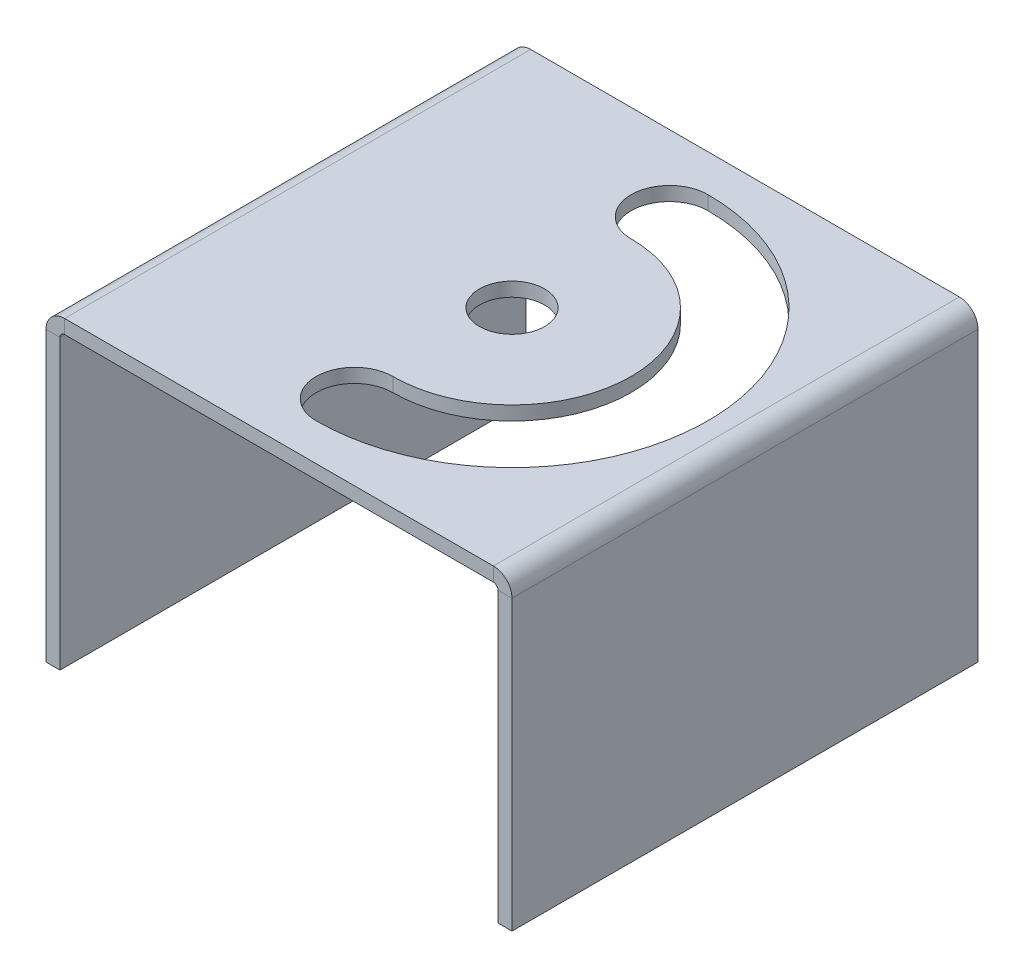
from build123d import *

# Parameters (mm, degrees)
BASE_FLANGE1_DEPTH = 50
SKETCH2_R          = 3.5
CUT_EXTRUDE1_DEPTH = 10
CUT_EXTRUDE2_DEPTH = 3


# Sheet-metal steps are written as plain solids
with BuildPart() as part:
    # Sketch1 → Base-Flange1 (new body)
    with BuildSketch(Plane.XY):
        with BuildLine():
            Line((-25, 0), (-25, 30.930870366))
            ThreePointArc((-25, 30.930870366), (-24.414213562, 32.345083928), (-23, 32.930870366))
            Line((-23, 32.930870366), (23, 32.930870366))
            ThreePointArc((23, 32.930870366), (24.414213562, 32.345083928), (25, 30.930870366))
            Line((25, 30.930870366), (25, 0))
            Line((25, 0), (23.5, 0))
            Line((23.5, 0), (23.5, 30.930870366))
            ThreePointArc((23.5, 30.930870366), (23.353553391, 31.284423757), (23, 31.430870366))
            Line((23, 31.430870366), (-23, 31.430870366))
            ThreePointArc((-23, 31.430870366), (-23.353553391, 31.284423757), (-23.5, 30.930870366))
            Line((-23.5, 30.930870366), (-23.5, 0))
            Line((-23.5, 0), (-25, 0))
        make_face()
    extrude(amount=BASE_FLANGE1_DEPTH)

    # Sketch2 → Cut-Extrude1 (cut)
    with BuildSketch(Plane(origin=(0, 32.930870366, 0), x_dir=(1, 0, 0), z_dir=(0, 1, 0))):
        with Locations(Location((0, -25, 0), (0, 0, 270))):
            Circle(SKETCH2_R)
    extrude(amount=-CUT_EXTRUDE1_DEPTH, mode=Mode.SUBTRACT)

    # Sketch3 → Cut-Extrude2 (cut)
    with BuildSketch(Plane(origin=(0, 32.930870366, 0), x_dir=(1, 0, 0), z_dir=(0, 1, 0))):
        with BuildLine():
            ThreePointArc((0, -37.783779882), (12.783779882, -25), (0, -12.216220118))
            ThreePointArc((0, -12.216220118), (-4.117379141, -8.098840977), (0, -3.981461837))
            ThreePointArc((0, -3.981461837), (21.018538163, -25), (0, -46.018538163))
            ThreePointArc((0, -46.018538163), (-4.117379141, -41.901159023), (0, -37.783779882))
        make_face()
    extrude(amount=-CUT_EXTRUDE2_DEPTH, mode=Mode.SUBTRACT)


solid = part.part
